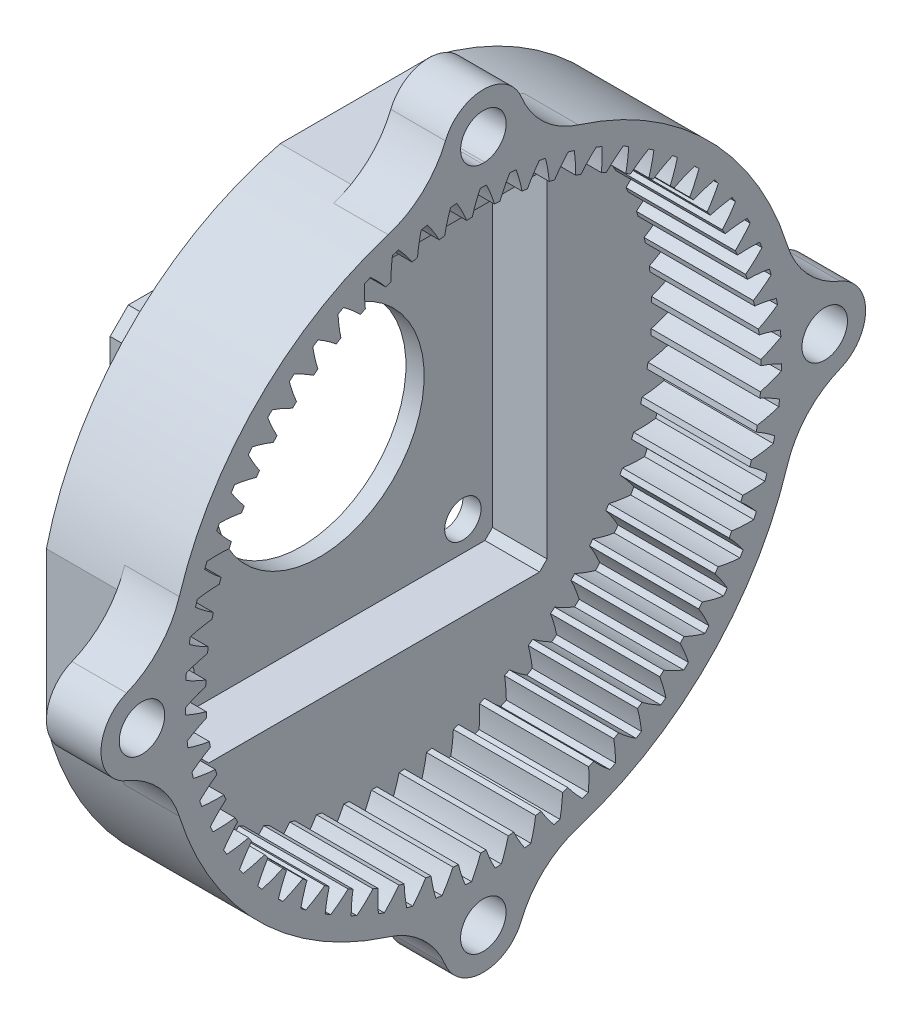
from build123d import *

# Parameters (mm, degrees)
BASPROSKE_W         = 12
BASPROSKE_H         = 4.5
TOOTHCUT_DEPTH      = 51.931326313
TEETHCUTS_COUNT     = 63
TEETHCUTS_ANGLE     = 354.285714286
SKETCH1_R           = 35
SKETCH1_R_2         = 17.5
BOSS_EXTRUDE1_DEPTH = 2
SKETCH4_W           = 42
SKETCH4_H           = 42
CUT_EXTRUDE2_DEPTH  = 10
CHAMFER1_SIZE       = 2
BOSS_EXTRUDE2_DEPTH = 8
SKETCH6_R           = 11.5
BOSS_EXTRUDE3_DEPTH = 2
SKETCH3_R           = 2
CUT_EXTRUDE3_DEPTH  = 51.931326313
SKETCH7_R           = 2.5
BOSS_EXTRUDE4_DEPTH = 10
SKETCH8_R           = 47.362247844
SKETCH8_R_2         = 35
CUT_EXTRUDE4_DEPTH  = 69.058798109
SKETCH9_R           = 2.5
BOSS_EXTRUDE6_DEPTH = 6
FILLET1_START       = 6
FILLET1_DEPTH       = 6
CUT_EXTRUDE6_START  = -8
CUT_EXTRUDE6_DEPTH  = 8


with BuildPart() as part:
    # BasProSke → Base-Revolve (revolve)
    with BuildSketch(Plane(origin=(0, 0, 0), x_dir=(1, 0, 0), z_dir=(0, 1, 0)), mode=Mode.PRIVATE) as base_revolve_sk:
        with Locations((6, 32.75)):
            Rectangle(BASPROSKE_W, BASPROSKE_H)
    revolve(base_revolve_sk.sketch.rotate(Axis((-10, 0, 0), (1, 0, 0)), 180), axis=Axis((-10, 0, 0), (1, 0, 0)))

    # TooCutSke → ToothCut (cut, through all)
    with BuildSketch(Plane(origin=(0, 0, 0), x_dir=(0, 0, -1), z_dir=(1, 0, 0))):
        with BuildLine():
            ThreePointArc((1.227046878, 30.449886718), (0.831500978, 31.616774754), (0.34595086, 32.749172799))
            ThreePointArc((0.34595086, 32.749172799), (0, 32.751), (-0.34595086, 32.749172799))
            ThreePointArc((-0.34595086, 32.749172799), (-0.831500978, 31.616774754), (-1.227046878, 30.449886718))
            ThreePointArc((-1.227046878, 30.449886718), (0, 30.4746), (1.227046878, 30.449886718))
        make_face()
    toothcut = extrude(amount=TOOTHCUT_DEPTH, mode=Mode.SUBTRACT)

    # TeethCuts: ToothCut ×63 about axis
    teethcuts_axis = Axis((-10, 0, 0), (1, 0, 0))
    for i in range(1, TEETHCUTS_COUNT):
        add(toothcut.rotate(teethcuts_axis, i * TEETHCUTS_ANGLE / (TEETHCUTS_COUNT - 1)), mode=Mode.SUBTRACT)

    # Sketch1 → Boss-Extrude1 (add)
    with BuildSketch(Plane.ZY):
        Circle(SKETCH1_R)
        Circle(SKETCH1_R_2, mode=Mode.SUBTRACT)
    extrude(amount=BOSS_EXTRUDE1_DEPTH)

    # Sketch4 → Cut-Extrude2 (cut)
    with BuildSketch(Plane(origin=(0, 0, 0), x_dir=(0, 0, -1), z_dir=(1, 0, 0))):
        Rectangle(SKETCH4_W, SKETCH4_H)
    extrude(amount=-CUT_EXTRUDE2_DEPTH, mode=Mode.SUBTRACT)

    # Chamfer1
    chamfer1_edges = [part.edges().sort_by_distance(p)[0] for p in [
        (-1, -21, 21),
        (-1, 21, 21),
        (-1, 21, -21),
        (-1, -21, -21),
    ]]
    chamfer(chamfer1_edges, length=CHAMFER1_SIZE)

    # Sketch5 → Boss-Extrude2 (add)
    with BuildSketch(Plane(origin=(0, 0, 0), x_dir=(0, 0, -1), z_dir=(1, 0, 0))):
        Polygon((19, 21), (-19, 21), (-21, 19), (-21, -19), (-19, -21), (19, -21), (21, -19), (21, 19), align=None)
        Polygon((18.171572875, 19), (-18.171572875, 19), (-20.5, 16.671572875), (-20.5, -16.671572875), (-18.171572875, -19), (18.171572875, -19), (19, -18.171572875), (19, 18.171572875), align=None, mode=Mode.SUBTRACT)
    extrude(amount=-BOSS_EXTRUDE2_DEPTH)

    # Sketch6 → Boss-Extrude3 (add)
    with BuildSketch(Plane.ZY.offset(8)):
        Polygon((-18.171572875, 19), (18.171572875, 19), (20.5, 16.671572875), (20.5, -16.671572875), (18.171572875, -19), (-18.171572875, -19), (-19, -18.171572875), (-19, 18.171572875), align=None)
        Circle(SKETCH6_R, mode=Mode.SUBTRACT)
    extrude(amount=-BOSS_EXTRUDE3_DEPTH)

    # Sketch3 → Cut-Extrude3 (cut, through all)
    with BuildSketch(Plane(origin=(0, 0, 0), x_dir=(0, 0, -1), z_dir=(1, 0, 0))):
        with Locations((15.75, 15.75)):
            Circle(SKETCH3_R)
        with Locations((15.75, -15.75)):
            Circle(SKETCH3_R)
        with Locations((-15.75, -15.75)):
            Circle(SKETCH3_R)
        with Locations((-15.75, 15.75)):
            Circle(SKETCH3_R)
    extrude(amount=-CUT_EXTRUDE3_DEPTH, mode=Mode.SUBTRACT)

    # Sketch7 → Boss-Extrude4 (add)
    # profile 1 of 4: a face of its own
    with BuildSketch(Plane(origin=(12, 0, 0), x_dir=(0, 0, -1), z_dir=(1, 0, 0))):
        with BuildLine():
            Line((6, 40), (6, 34.481879299))
            ThreePointArc((6, 34.481879299), (0, 35), (-6, 34.481879299))
            Line((-6, 34.481879299), (-6, 40))
            ThreePointArc((-6, 40), (0, 46), (6, 40))
        make_face()
        with Locations((0, 40)):
            Circle(SKETCH7_R, mode=Mode.SUBTRACT)
    # profile 2 of 4: a face of its own
    with BuildSketch(Plane(origin=(12, 0, 0), x_dir=(0, 0, -1), z_dir=(1, 0, 0))):
        with BuildLine():
            Line((-40, 6), (-34.481879299, 6))
            ThreePointArc((-34.481879299, 6), (-35, 0), (-34.481879299, -6))
            Line((-34.481879299, -6), (-40, -6))
            ThreePointArc((-40, -6), (-46, 0), (-40, 6))
        make_face()
        with Locations((-40, 0)):
            Circle(SKETCH7_R, mode=Mode.SUBTRACT)
    # profile 3 of 4: a face of its own
    with BuildSketch(Plane(origin=(12, 0, 0), x_dir=(0, 0, -1), z_dir=(1, 0, 0))):
        with BuildLine():
            Line((-6, -34.481879299), (-6, -40))
            ThreePointArc((-6, -40), (0, -46), (6, -40))
            Line((6, -40), (6, -34.481879299))
            ThreePointArc((6, -34.481879299), (0, -35), (-6, -34.481879299))
        make_face()
        with Locations((0, -40)):
            Circle(SKETCH7_R, mode=Mode.SUBTRACT)
    # profile 4 of 4: a face of its own
    with BuildSketch(Plane(origin=(12, 0, 0), x_dir=(0, 0, -1), z_dir=(1, 0, 0))):
        with BuildLine():
            Line((34.481879299, -6), (40, -6))
            ThreePointArc((40, -6), (46, 0), (40, 6))
            Line((40, 6), (34.481879299, 6))
            ThreePointArc((34.481879299, 6), (35, 0), (34.481879299, -6))
        make_face()
        with Locations((40, 0)):
            Circle(SKETCH7_R, mode=Mode.SUBTRACT)
    extrude(amount=-BOSS_EXTRUDE4_DEPTH)

    # Sketch8 → Cut-Extrude4 (cut, through all)
    with BuildSketch(Plane(origin=(12, 0, 0), x_dir=(0, 0, -1), z_dir=(1, 0, 0))):
        Circle(SKETCH8_R)
        with Locations(Location((0, 0, 0), (0, 0, 180))):
            Circle(SKETCH8_R_2, mode=Mode.SUBTRACT)
    extrude(amount=-CUT_EXTRUDE4_DEPTH, mode=Mode.SUBTRACT)

    # Sketch9 → Boss-Extrude6 (add)
    # profile 1 of 4: a face of its own
    with BuildSketch(Plane(origin=(12, 0, 0), x_dir=(0, 0, -1), z_dir=(1, 0, 0))):
        with BuildLine():
            ThreePointArc((-33.57435919, 4.491892697), (-33.873510225, -0.000200068), (-33.574306126, -4.492289298))
            Line((-33.574306126, -4.492289298), (-37.23, -4.491892697))
            ThreePointArc((-37.23, -4.491892697), (-42, 0), (-37.23, 4.491892697))
            Line((-37.23, 4.491892697), (-33.57435919, 4.491892697))
        make_face()
        with Locations((-37.5, 0)):
            Circle(SKETCH9_R, mode=Mode.SUBTRACT)
    # profile 2 of 4: a face of its own
    with BuildSketch(Plane(origin=(12, 0, 0), x_dir=(0, 0, -1), z_dir=(1, 0, 0))):
        with BuildLine():
            ThreePointArc((4.495510978, 33.573874904), (0.003417796, 33.873510053), (-4.488735761, 33.574781403))
            Line((-4.488735761, 33.574781403), (-4.488364327, 37.230425537))
            ThreePointArc((-4.488364327, 37.230425537), (0.004266999, 41.995702447), (4.495929874, 37.229512682))
            Line((4.495929874, 37.229512682), (4.495510978, 33.573874904))
        make_face()
        with Locations((0.003809774, 37.49570247)):
            Circle(SKETCH9_R, mode=Mode.SUBTRACT)
    # profile 3 of 4: a face of its own
    with BuildSketch(Plane(origin=(12, 0, 0), x_dir=(0, 0, -1), z_dir=(1, 0, 0))):
        with BuildLine():
            ThreePointArc((33.573330611, -4.499574054), (33.873510004, -0.003874959), (33.57435919, 4.491892697))
            Line((33.57435919, 4.491892697), (37.499512244, 4.491892697))
            ThreePointArc((37.499512244, 4.491892697), (41.997477622, -0.143412359), (37.229024485, -4.499970655))
            Line((37.229024485, -4.499970655), (33.573330611, -4.499574054))
        make_face()
        with Locations((37.499512244, -0.008107303)):
            Circle(SKETCH9_R, mode=Mode.SUBTRACT)
    # profile 4 of 4: a face of its own
    with BuildSketch(Plane(origin=(12, 0, 0), x_dir=(0, 0, -1), z_dir=(1, 0, 0))):
        with BuildLine():
            Line((-4.495558439, -33.573868548), (-4.495929873, -37.229512683))
            ThreePointArc((-4.495929873, -37.229512683), (-0.004813181, -42.003809744), (4.487397559, -37.230542074))
            Line((4.487397559, -37.230542074), (4.487816455, -33.574904296))
            ThreePointArc((4.487816455, -33.574904296), (-0.00390548, -33.87351), (-4.495558439, -33.573868548))
        make_face()
        with Locations((-0.00429753, -37.503809774)):
            Circle(SKETCH9_R, mode=Mode.SUBTRACT)
    extrude(amount=-BOSS_EXTRUDE6_DEPTH)

    # Fillet1: read off the stored shape, not the designer's step
    # Fillet1 outline → Fillet1 (add)
    with BuildSketch(Plane.YZ.offset(FILLET1_START)):
        with BuildLine():
            ThreePointArc((-4.49969732, -34.709548024), (-7.507891161, -34.185253697), (-10.458938521, -33.400757552))
            ThreePointArc((-10.458938521, -33.400757552), (-6.669858578, -35.590766957), (-4.178862279, -39.189128452))
            ThreePointArc((-4.178862279, -39.189128452), (-4.448911393, -38.227014159), (-4.499970655, -37.229024485))
            Line((-4.499970655, -37.229024485), (-4.49969732, -34.709548024))
        make_face()
        with BuildLine():
            ThreePointArc((-39.19327846, -4.166517206), (-35.593745433, -6.658561794), (-33.403730359, -10.449440086))
            ThreePointArc((-33.403730359, -10.449440086), (-34.187618495, -7.497115557), (-34.711103008, -4.487686259))
            Line((-34.711103008, -4.487686259), (-37.230542074, -4.487397559))
            ThreePointArc((-37.230542074, -4.487397559), (-38.229858917, -4.436744313), (-39.19327846, -4.166517206))
        make_face()
        with BuildLine():
            ThreePointArc((4.491892697, -37.499512244), (4.40862837, -38.361165301), (4.161916701, -39.190931709))
            ThreePointArc((4.161916701, -39.190931709), (6.654468681, -35.593647644), (10.444495219, -33.405276823))
            ThreePointArc((10.444495219, -33.405276823), (7.496656677, -34.187719121), (4.491892697, -34.710558912))
            Line((4.491892697, -34.710558912), (4.491892697, -37.499512244))
        make_face()
        with BuildLine():
            ThreePointArc((-33.401334697, 10.457095221), (-35.5922185, 6.666718933), (-39.192322555, 4.175499345))
            ThreePointArc((-39.192322555, 4.175499345), (-38.228841108, 4.44550565), (-37.229512683, 4.495929873))
            Line((-37.229512683, 4.495929873), (-34.71006938, 4.495673883))
            ThreePointArc((-34.71006938, 4.495673883), (-34.185895884, 7.504966528), (-33.401334697, 10.457095221))
        make_face()
        with BuildLine():
            ThreePointArc((34.710073616, -4.495641174), (34.186276939, -7.503230576), (33.402386686, -10.453734438))
            ThreePointArc((33.402386686, -10.453734438), (35.590844994, -6.665356134), (39.187151071, -4.17382196))
            ThreePointArc((39.187151071, -4.17382196), (38.22630431, -4.444104916), (37.229512682, -4.495929874))
            Line((37.229512682, -4.495929874), (34.710073616, -4.495641174))
        make_face()
        with BuildLine():
            ThreePointArc((-4.170459731, 39.190344828), (-6.662217866, 35.592295821), (-10.451892905, 33.402962963))
            ThreePointArc((-10.451892905, 33.402962963), (-7.500576847, 34.186859273), (-4.492166031, 34.710523539))
            Line((-4.492166031, 34.710523539), (-4.491892697, 37.23))
            ThreePointArc((-4.491892697, 37.23), (-4.440700998, 38.228130926), (-4.170459731, 39.190344828))
        make_face()
        with BuildLine():
            ThreePointArc((37.230425537, 4.488364327), (38.227206612, 4.436336811), (39.187998429, 4.165858605))
            ThreePointArc((39.187998429, 4.165858605), (35.592198734, 6.658123538), (33.404510312, 10.446946483))
            ThreePointArc((33.404510312, 10.446946483), (34.187797441, 7.496299495), (34.710982234, 4.488620316))
            Line((34.710982234, 4.488620316), (37.230425537, 4.488364327))
        make_face()
        with BuildLine():
            ThreePointArc((10.451892905, 33.402962963), (6.662217866, 35.592295821), (4.170459731, 39.190344828))
            ThreePointArc((4.170459731, 39.190344828), (4.440700998, 38.228130926), (4.491892697, 37.23))
            Line((4.491892697, 37.23), (4.491892697, 34.710558912))
            ThreePointArc((4.491892697, 34.710558912), (7.500442242, 34.186888805), (10.451892905, 33.402962963))
        make_face()
    extrude(amount=FILLET1_DEPTH)

    # Sketch11 → Cut-Extrude6 (cut)
    with BuildSketch(Plane.ZY.offset(2).offset(CUT_EXTRUDE6_START)):
        with BuildLine():
            Line((-8.306623863, -34), (8.306623863, -34))
            ThreePointArc((8.306623863, -34), (0, -35), (-8.306623863, -34))
        make_face()
        with BuildLine():
            Line((-34, -8.306623863), (-34, 8.306623863))
            ThreePointArc((-34, 8.306623863), (-35, 0), (-34, -8.306623863))
        make_face()
        with BuildLine():
            Line((-8.306623863, 34), (8.306623863, 34))
            ThreePointArc((8.306623863, 34), (0, 35), (-8.306623863, 34))
        make_face()
        with BuildLine():
            Line((34, -8.306623863), (34, 8.306623863))
            ThreePointArc((34, 8.306623863), (35, 0), (34, -8.306623863))
        make_face()
    extrude(amount=CUT_EXTRUDE6_DEPTH, mode=Mode.SUBTRACT)


solid = part.part
